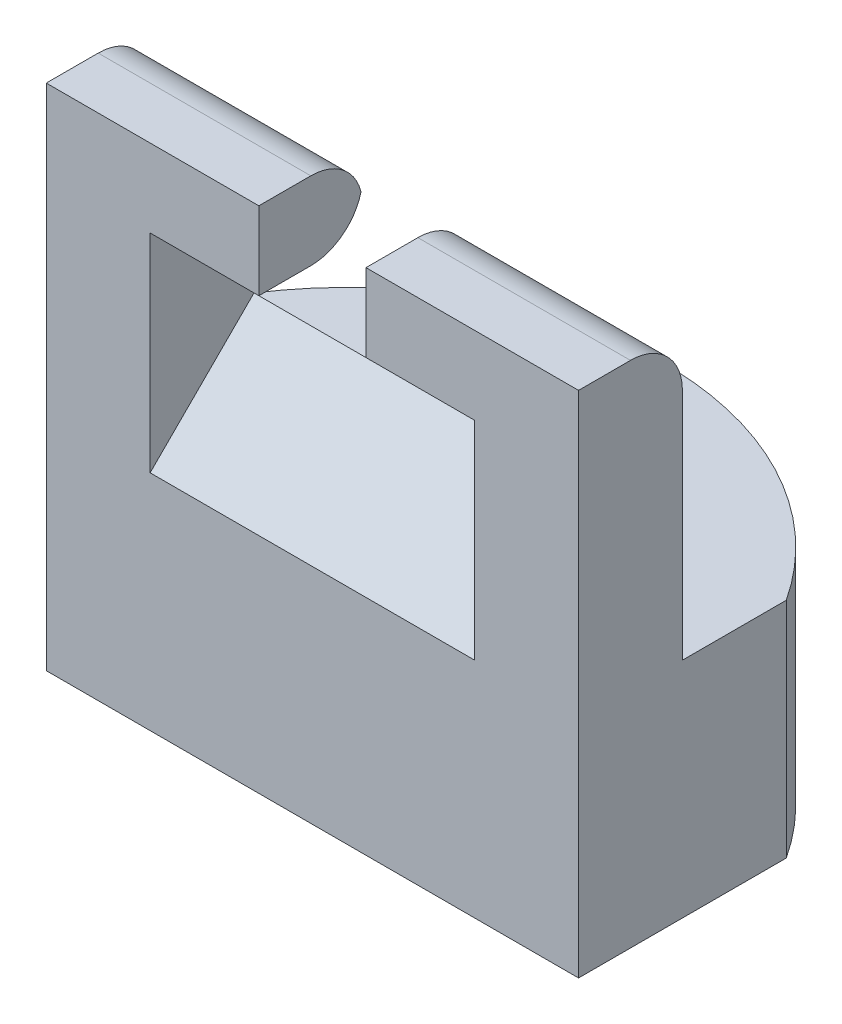
from build123d import *

# Parameters (mm, degrees)
PROFILEBOSS_EXTRUDE1_DEPTH    = 4.3
ANGLESKETCH7_W                = 10.25
ANGLESKETCH7_H                = 2
ANGLEBOSS_EXTRUDE3_DEPTH      = 5.5
UNDERROLLERSKETCH10_W         = 6.25
UNDERROLLERSKETCH10_H         = 2
UNDERROLLERCUT_EXTRUDE5_DEPTH = 16.714565224
UNDERFILLET22_R               = 1
OPENNINGCUT_EXTRUDE1_REACH    = 17.715
SKETCH2_W                     = 2.0625
SKETCH2_H                     = 2
OUTCHAMFER1_SIZE              = 2
TOPFILLET1_R                  = 1
CLAMPMOUNTHOLESKETCH3_R       = 2.05
CUT_EXTRUDE1_DEPTH            = 4.1


with BuildPart() as part:
    # Sketch1 → ProfileBoss-Extrude1 (new body)
    with BuildSketch(Plane(origin=(0, 0, 0), x_dir=(1, 0, 0), z_dir=(0, 1, 0))):
        with BuildLine():
            Line((10.25, 4), (10.25, 0))
            Line((10.25, 0), (0, 0))
            Line((0, 0), (0, 4))
            ThreePointArc((0, 4), (5.125, 6.770898034), (10.25, 4))
        make_face()
    extrude(amount=PROFILEBOSS_EXTRUDE1_DEPTH)

    # AngleSketch7 → AngleBoss-Extrude3 (add)
    with BuildSketch(Plane(origin=(0, 4.3, 0), x_dir=(1, 0, 0), z_dir=(0, 1, 0))):
        with Locations((5.125, 1)):
            Rectangle(ANGLESKETCH7_W, ANGLESKETCH7_H)
    extrude(amount=ANGLEBOSS_EXTRUDE3_DEPTH)

    # UnderRollerSketch10 → UnderRollerCut-Extrude5 (cut, through all)
    with BuildSketch(Plane.XY):
        with Locations((5.125, 7.3)):
            Rectangle(UNDERROLLERSKETCH10_W, UNDERROLLERSKETCH10_H)
    extrude(amount=-UNDERROLLERCUT_EXTRUDE5_DEPTH, mode=Mode.SUBTRACT)

    # UnderFillet22
    underfillet22_edges = [part.edges().sort_by_distance(p)[0] for p in [
        (5.125, 8.3, -2),
    ]]
    fillet(underfillet22_edges, radius=UNDERFILLET22_R)

    # Sketch2 → OpenningCut-Extrude1 (cut, up to next)
    with BuildSketch(Plane(origin=(0, 9.8, 0), x_dir=(1, 0, 0), z_dir=(0, 1, 0)), mode=Mode.PRIVATE) as openningcut_extrude1_sk1:
        with Locations((5.125, 1)):
            Rectangle(SKETCH2_W, SKETCH2_H)
    openningcut_extrude1_tool1 = extrude(openningcut_extrude1_sk1.sketch, amount=-OPENNINGCUT_EXTRUDE1_REACH, mode=Mode.PRIVATE) & part.part
    add(openningcut_extrude1_tool1.solids().sort_by_distance((5.125, 9.8, -1))[0], mode=Mode.SUBTRACT)

    # OutChamfer1
    outchamfer1_edges = [part.edges().sort_by_distance(p)[0] for p in [
        (5.125, 6.3, 0),
    ]]
    chamfer(outchamfer1_edges, length=OUTCHAMFER1_SIZE - 0.0001)  # a hair under: the kernel refuses the full size

    # TopFillet1
    topfillet1_edges = [part.edges().sort_by_distance(p)[0] for p in [
        (8.203125, 9.8, -2),
        (2.046875, 9.8, -2),
    ]]
    fillet(topfillet1_edges, radius=TOPFILLET1_R)

    # ClampMountHoleSketch3 → Cut-Extrude1 (cut)
    with BuildSketch(Plane.XZ):
        with Locations(Location((5.125, -4, 0), (0, 0, 270))):
            Circle(CLAMPMOUNTHOLESKETCH3_R)
    extrude(amount=-CUT_EXTRUDE1_DEPTH, mode=Mode.SUBTRACT)


solid = part.part
